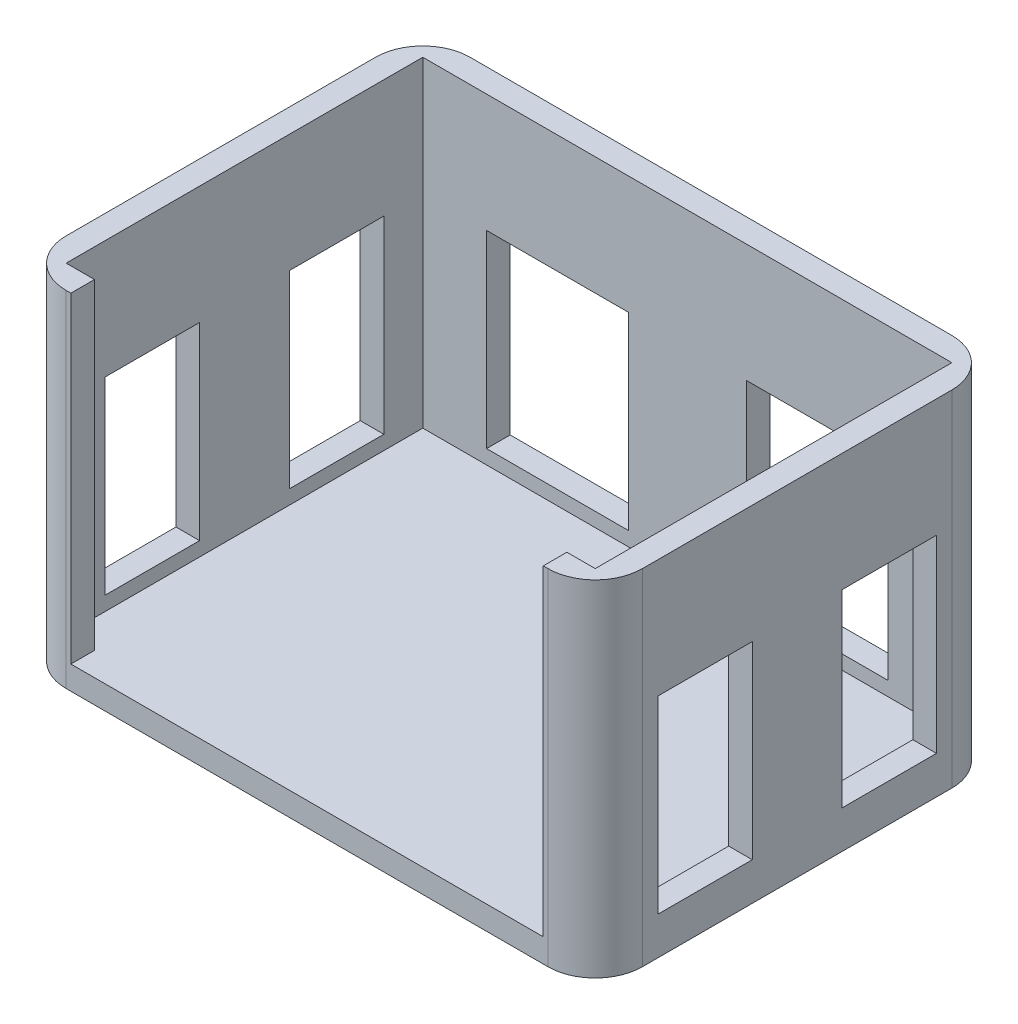
from build123d import *

# Parameters (mm, degrees)
SKETCH1_W               = 122
SKETCH1_H               = 85.5
BOSS_EXTRUDE1_DEPTH     = 5
BOSS_EXTRUDE2_DEPTH     = 68
CUT_EXTRUDE1_DEPTH      = 166.901326095
CUT_EXTRUDE1_DEPTH_BACK = 166.901326095
SKETCH3_W               = 20
SKETCH3_H               = 40
CUT_EXTRUDE2_REACH      = 167.901
SKETCH4_W               = 30
SKETCH4_H               = 40
FILLET1_R               = 10


with BuildPart() as part:
    # Sketch1 → Boss-Extrude1 (new body)
    with BuildSketch(Plane(origin=(0, 0, 0), x_dir=(1, 0, 0), z_dir=(0, 1, 0))):
        with Locations((61, 42.75)):
            Rectangle(SKETCH1_W, SKETCH1_H)
    extrude(amount=BOSS_EXTRUDE1_DEPTH)

    # Sketch2 → Boss-Extrude2 (add)
    with BuildSketch(Plane(origin=(0, 5, 0), x_dir=(1, 0, 0), z_dir=(0, 1, 0))):
        Polygon((5, 5), (11, 5), (11, 0), (0, 0), (0, 85.5), (122, 85.5), (122, 0), (111, 0), (111, 5), (117, 5), (117, 80.5), (5, 80.5), align=None)
    extrude(amount=BOSS_EXTRUDE2_DEPTH)

    # Sketch3 → Cut-Extrude1 (cut, two sides: drawn at the far end of the back side and taken through both)
    with BuildSketch(Plane(origin=(122, 0, 0), x_dir=(0, 0, -1), z_dir=(1, 0, 0)).offset(-CUT_EXTRUDE1_DEPTH_BACK)):
        with Locations((23.25, 28)):
            Rectangle(SKETCH3_W, SKETCH3_H)
        with Locations((62.25, 28)):
            Rectangle(SKETCH3_W, SKETCH3_H)
    extrude(amount=CUT_EXTRUDE1_DEPTH + CUT_EXTRUDE1_DEPTH_BACK, mode=Mode.SUBTRACT)

    # Sketch4 → Cut-Extrude2 (cut, up to next)
    with BuildSketch(Plane(origin=(0, 0, -85.5), x_dir=(-1, 0, 0), z_dir=(0, 0, -1)), mode=Mode.PRIVATE) as cut_extrude2_sk1:
        with Locations((-88.5, 28)):
            Rectangle(SKETCH4_W, SKETCH4_H)
    cut_extrude2_tool1 = extrude(cut_extrude2_sk1.sketch, amount=-CUT_EXTRUDE2_REACH, mode=Mode.PRIVATE) & part.part
    # Sketch4 → Cut-Extrude2 (cut, up to next)
    with BuildSketch(Plane(origin=(0, 0, -85.5), x_dir=(-1, 0, 0), z_dir=(0, 0, -1)), mode=Mode.PRIVATE) as cut_extrude2_sk2:
        with Locations((-33.5, 28)):
            Rectangle(SKETCH4_W, SKETCH4_H)
    cut_extrude2_tool2 = extrude(cut_extrude2_sk2.sketch, amount=-CUT_EXTRUDE2_REACH, mode=Mode.PRIVATE) & part.part
    add(cut_extrude2_tool1.solids().sort_by_distance((88.5, 28, -85.5))[0], mode=Mode.SUBTRACT)
    add(cut_extrude2_tool2.solids().sort_by_distance((33.5, 28, -85.5))[0], mode=Mode.SUBTRACT)

    # Fillet1
    fillet1_edges = [part.edges().sort_by_distance(p)[0] for p in [
        (122, 36.5, 0),
        (122, 36.5, -85.5),
        (0, 36.5, -85.5),
        (0, 36.5, 0),
    ]]
    fillet(fillet1_edges, radius=FILLET1_R)


solid = part.part
